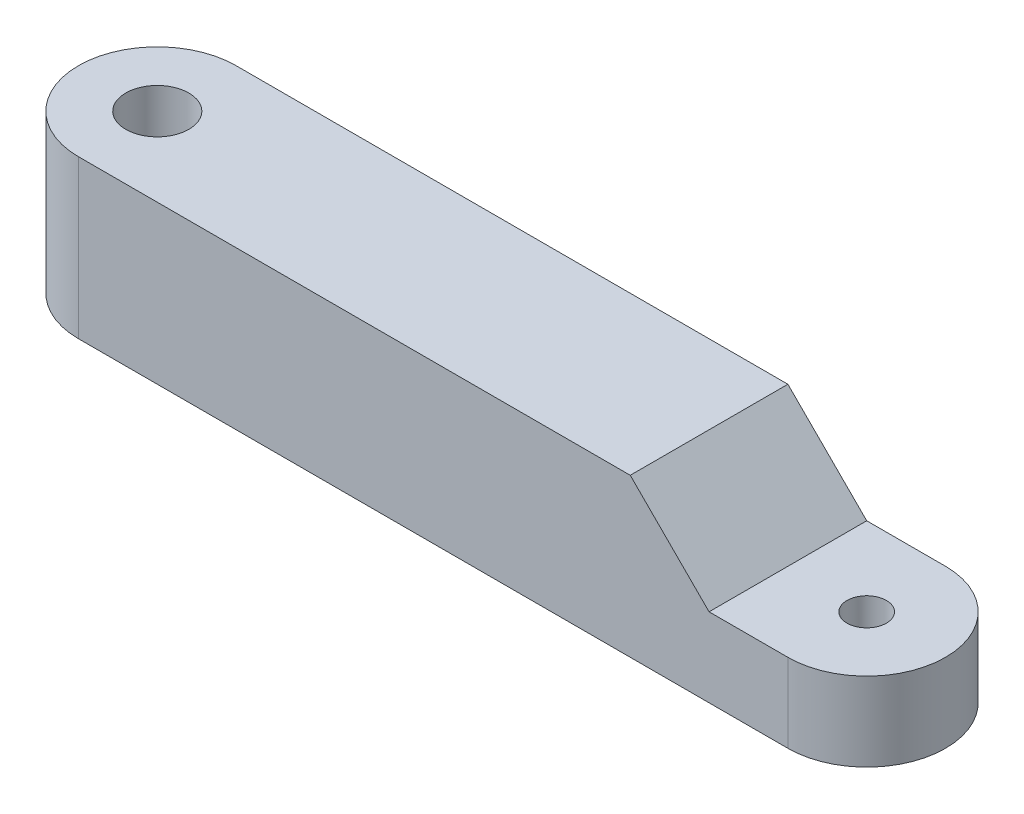
from build123d import *

# Parameters (mm, degrees)
ESQUISSE1_R                     = 2
BOSS_EXTRU_1_DEPTH              = 5
TROU_TARAUD_M3X0_51_D           = 2.5
TROU_TARAUD_M3X0_51_CSINK_D     = 3.05
TROU_TARAUD_M3X0_51_CSINK_ANGLE = 90
ENL_V_MAT_EXTRU_1_DEPTH         = 51.497524692
ENL_V_MAT_EXTRU_1_DEPTH_BACK    = 51.497524692


with BuildPart() as part:
    # Esquisse1 → Boss.-Extru.1 (new, symmetric)
    with BuildSketch(Plane(origin=(0, 0, 0), x_dir=(1, 0, 0), z_dir=(0, 1, 0))):
        with BuildLine():
            Line((0, 5), (45, 5))
            ThreePointArc((45, 5), (50, 0), (45, -5))
            Line((45, -5), (0, -5))
            ThreePointArc((0, -5), (-5, 0), (0, 5))
        make_face()
        Circle(ESQUISSE1_R, mode=Mode.SUBTRACT)
    extrude(amount=BOSS_EXTRU_1_DEPTH, both=True)

    # Trou taraudé M3x0.51 (through all)
    with Locations(Plane(origin=(0, 5, 0), x_dir=(1, 0, 0), z_dir=(0, 1, 0))):
        with Locations((45, 0)):
            CounterSinkHole(TROU_TARAUD_M3X0_51_D / 2, TROU_TARAUD_M3X0_51_CSINK_D / 2, counter_sink_angle=TROU_TARAUD_M3X0_51_CSINK_ANGLE)

    # Esquisse4 → Enlèv. mat.-Extru.1 (cut, two sides: drawn at the far end of the back side and taken through both)
    with BuildSketch(Plane.XY.offset(-ENL_V_MAT_EXTRU_1_DEPTH_BACK)):
        Polygon((35, 5), (50, 5), (50, 0), (40, 0), align=None)
    extrude(amount=ENL_V_MAT_EXTRU_1_DEPTH + ENL_V_MAT_EXTRU_1_DEPTH_BACK, mode=Mode.SUBTRACT)


solid = part.part
